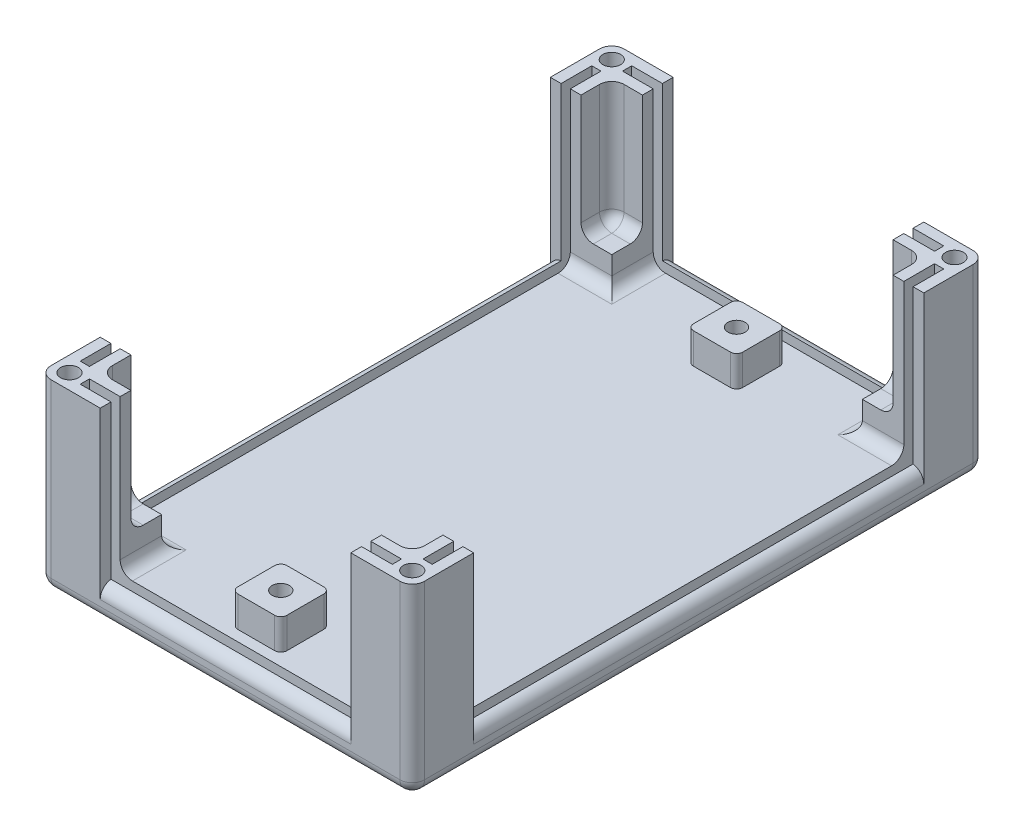
from build123d import *

# Parameters (mm, degrees)
SKETCH1_W           = 60.8
SKETCH1_H           = 93.28
SKETCH1_R           = 1.4
BOSS_EXTRUDE1_DEPTH = 5
BOSS_EXTRUDE3_DEPTH = 30
BOSS_EXTRUDE4_START = 5
SKETCH1_6_W         = 8
SKETCH1_6_H         = 8
SKETCH1_6_R         = 1.4
BOSS_EXTRUDE4_DEPTH = 5
SKETCH1_8_R         = 1.4
CUT_EXTRUDE4_DEPTH  = 2.3
SKETCH4_W           = 5
SKETCH4_H           = 5
BOSS_EXTRUDE5_DEPTH = 5
SKETCH2_W           = 1.5
SKETCH2_H           = 83.28
SKETCH2_W_2         = 50.8
SKETCH2_H_2         = 1.5
SKETCH2_H_3         = 78.28
SKETCH2_W_3         = 45.8
SKETCH2_W_4         = 5
SKETCH2_H_4         = 5
CUT_EXTRUDE1_DEPTH  = 27
SKETCH2_3_R         = 1.45
CUT_EXTRUDE2_DEPTH  = 15
SKETCH3_W           = 34
SKETCH3_H           = 34
CUT_EXTRUDE3_DEPTH  = 2
FILLET1_R           = 2
FILLET3_R           = 1
FILLET5_R           = 4
FILLET6_R           = 2


with BuildPart() as part:
    # Sketch1 → Boss-Extrude1 (new body)
    with BuildSketch(Plane(origin=(0, 0, 0), x_dir=(1, 0, 0), z_dir=(0, 1, 0))):
        Rectangle(SKETCH1_W, SKETCH1_H)
        with Locations(Location((0, -37.64, 0), (0, 0, 270))):
            Circle(SKETCH1_R, mode=Mode.SUBTRACT)
        with Locations(Location((0, 36.56, 0), (0, 0, 270))):
            Circle(SKETCH1_R, mode=Mode.SUBTRACT)
    extrude(amount=BOSS_EXTRUDE1_DEPTH)

    # Sketch1<4> → Boss-Extrude3 (add)
    with BuildSketch(Plane(origin=(0, 0, 0), x_dir=(1, 0, 0), z_dir=(0, 1, 0))):
        Polygon((-20.4, 41.64), (-20.4, 46.64), (-30.4, 46.64), (-30.4, 36.64), (-25.4, 36.64), (-25.4, 41.64), align=None)
        Polygon((25.4, 36.64), (30.4, 36.64), (30.4, 46.64), (20.4, 46.64), (20.4, 41.64), (25.4, 41.64), align=None)
        Polygon((20.4, -46.64), (30.4, -46.64), (30.4, -36.64), (25.4, -36.64), (25.4, -41.64), (20.4, -41.64), align=None)
        Polygon((-30.4, -46.64), (-20.4, -46.64), (-20.4, -41.64), (-25.4, -41.64), (-25.4, -36.64), (-30.4, -36.64), align=None)
    extrude(amount=BOSS_EXTRUDE3_DEPTH)

    # Sketch1<6> → Boss-Extrude4 (add)
    # profile 1 of 2: a face of its own
    with BuildSketch(Plane(origin=(0, 0, 0), x_dir=(1, 0, 0), z_dir=(0, 1, 0)).offset(BOSS_EXTRUDE4_START)):
        with Locations((0, -37.64)):
            Rectangle(SKETCH1_6_W, SKETCH1_6_H)
        with Locations(Location((0, -37.64, 0), (0, 0, 270))):
            Circle(SKETCH1_6_R, mode=Mode.SUBTRACT)
    # profile 2 of 2: a face of its own
    with BuildSketch(Plane(origin=(0, 0, 0), x_dir=(1, 0, 0), z_dir=(0, 1, 0)).offset(BOSS_EXTRUDE4_START)):
        with Locations((0, 36.56)):
            Rectangle(SKETCH1_6_W, SKETCH1_6_H)
        with Locations(Location((0, 36.56, 0), (0, 0, 270))):
            Circle(SKETCH1_6_R, mode=Mode.SUBTRACT)
    extrude(amount=BOSS_EXTRUDE4_DEPTH)

    # Sketch1<8> → Cut-Extrude4 (cut)
    # profile 1 of 2: a face of its own
    with BuildSketch(Plane(origin=(0, 0, 0), x_dir=(1, 0, 0), z_dir=(0, 1, 0))):
        Polygon((-1.58771324, -40.39), (1.58771324, -40.39), (3.175426481, -37.64), (1.58771324, -34.89), (-1.58771324, -34.89), (-3.175426481, -37.64), align=None)
        with Locations(Location((0, -37.64, 0), (0, 0, 270))):
            Circle(SKETCH1_8_R, mode=Mode.SUBTRACT)
    # profile 2 of 2: a face of its own
    with BuildSketch(Plane(origin=(0, 0, 0), x_dir=(1, 0, 0), z_dir=(0, 1, 0))):
        Polygon((-1.58771324, 33.81), (1.58771324, 33.81), (3.175426481, 36.56), (1.58771324, 39.31), (-1.58771324, 39.31), (-3.175426481, 36.56), align=None)
        with Locations(Location((0, 36.56, 0), (0, 0, 270))):
            Circle(SKETCH1_8_R, mode=Mode.SUBTRACT)
    extrude(amount=CUT_EXTRUDE4_DEPTH, mode=Mode.SUBTRACT)

    # Sketch4 → Boss-Extrude5 (add)
    with BuildSketch(Plane(origin=(0, 5, 0), x_dir=(1, 0, 0), z_dir=(0, 1, 0))):
        with Locations((-22.9, -39.14)):
            Rectangle(SKETCH4_W, SKETCH4_H)
        with Locations((-22.9, 39.14)):
            Rectangle(SKETCH4_W, SKETCH4_H)
        with Locations((22.9, 39.14)):
            Rectangle(SKETCH4_W, SKETCH4_H)
        with Locations((22.9, -39.14)):
            Rectangle(SKETCH4_W, SKETCH4_H)
    extrude(amount=BOSS_EXTRUDE5_DEPTH)

    # Sketch2 → Cut-Extrude1 (cut)
    with BuildSketch(Plane(origin=(0, 30, 0), x_dir=(1, 0, 0), z_dir=(0, 1, 0))):
        with Locations((27.9, 0)):
            Rectangle(SKETCH2_W, SKETCH2_H)
        with Locations((0, -44.14)):
            Rectangle(SKETCH2_W_2, SKETCH2_H_2)
        with Locations((-27.9, -2.5)):
            Rectangle(SKETCH2_W, SKETCH2_H_3)
        with Locations((2.5, 44.14)):
            Rectangle(SKETCH2_W_3, SKETCH2_H_2)
        with Locations((-22.9, 44.14)):
            Rectangle(SKETCH2_W_4, SKETCH2_H_2)
        with Locations((-27.9, 39.14)):
            Rectangle(SKETCH2_W, SKETCH2_H_4)
    extrude(amount=-CUT_EXTRUDE1_DEPTH, mode=Mode.SUBTRACT)

    # Sketch2<3> → Cut-Extrude2 (cut)
    with BuildSketch(Plane(origin=(0, 30, 0), x_dir=(1, 0, 0), z_dir=(0, 1, 0))):
        with Locations(Location((27.9, -44.14, 0), (0, 0, 270))):
            Circle(SKETCH2_3_R)
        with Locations(Location((-27.9, -44.14, 0), (0, 0, 90))):
            Circle(SKETCH2_3_R)
        with Locations(Location((-27.9, 44.14, 0), (0, 0, 270))):
            Circle(SKETCH2_3_R)
        with Locations(Location((27.9, 44.14, 0), (0, 0, 90))):
            Circle(SKETCH2_3_R)
    extrude(amount=-CUT_EXTRUDE2_DEPTH, mode=Mode.SUBTRACT)

    # Sketch3 → Cut-Extrude3 (cut)
    with BuildSketch(Plane.XZ):
        Rectangle(SKETCH3_W, SKETCH3_H)
    extrude(amount=-CUT_EXTRUDE3_DEPTH, mode=Mode.SUBTRACT)

    # Fillet1
    # the kernel refuses this fillet: 2 mm, written as the material it adds along each edge
    with BuildSketch(Plane(origin=(-25.4, 5, 41.64), x_dir=(0, 0, -1), z_dir=(0, 1, 0)), Plane(origin=(-25.4, 5, -41.64), x_dir=(1, 0, 0), z_dir=(0, 1, 0)), Plane(origin=(25.4, 5, 41.64), x_dir=(-1, 0, 0), z_dir=(0, 1, 0)), Plane(origin=(25.4, 5, -41.64), x_dir=(0, 0, 1), z_dir=(0, 1, 0))) as fillet1_piece_1:
        with BuildLine():
            CenterArc((FILLET1_R, -FILLET1_R), FILLET1_R, 90, 90)
            Line((0, -FILLET1_R), (0, 0))
            Line((0, 0), (FILLET1_R, 0))
        make_face()
    extrude(amount=25)
    # the kernel refuses this fillet: 2 mm, written as the material it takes off along each edge
    with BuildSketch(Plane(origin=(28.4, 2, 44.64), x_dir=(0, -1, 0), z_dir=(1, 0, 0))) as fillet1_2_piece_1_section:
        Polygon((0, 0), (FILLET1_R * 1.02, 0), (FILLET1_R * 1.02, -FILLET1_R * 1.02), (0, -FILLET1_R * 1.02), align=None)
    fillet1_2_piece_1 = extrude(amount=FILLET1_R * 1.02, mode=Mode.PRIVATE)
    fillet1_2_piece_1 = fillet1_2_piece_1 - Plane(origin=(28.4, 2, 44.64), x_dir=(0, 0.7071067811865475, -0.7071067811865475), z_dir=(1, 0, 0)) * Sphere(FILLET1_R, mode=Mode.PRIVATE)
    add(fillet1_2_piece_1, mode=Mode.SUBTRACT)
    with BuildSketch(Plane(origin=(-28.4, 2, 44.64), x_dir=(0, 0, 1), z_dir=(-1, 0, 0))) as fillet1_2_piece_2_section:
        Polygon((0, 0), (FILLET1_R * 1.02, 0), (FILLET1_R * 1.02, -FILLET1_R * 1.02), (0, -FILLET1_R * 1.02), align=None)
    fillet1_2_piece_2 = extrude(amount=FILLET1_R * 1.02, mode=Mode.PRIVATE)
    fillet1_2_piece_2 = fillet1_2_piece_2 - Plane(origin=(-28.4, 2, 44.64), x_dir=(0, 0.7071067811865475, -0.7071067811865475), z_dir=(-1, 0, 0)) * Sphere(FILLET1_R, mode=Mode.PRIVATE)
    add(fillet1_2_piece_2, mode=Mode.SUBTRACT)
    with BuildSketch(Plane(origin=(-28.4, 2, -44.64), x_dir=(-1, 0, 0), z_dir=(0, 0, -1))) as fillet1_2_piece_3_section:
        Polygon((0, 0), (FILLET1_R * 1.02, 0), (FILLET1_R * 1.02, -FILLET1_R * 1.02), (0, -FILLET1_R * 1.02), align=None)
    fillet1_2_piece_3 = extrude(amount=FILLET1_R * 1.02, mode=Mode.PRIVATE)
    fillet1_2_piece_3 = fillet1_2_piece_3 - Plane(origin=(-28.4, 2, -44.64), x_dir=(0.7071067811865475, 0.7071067811865475, 0), z_dir=(0, 0, -1)) * Sphere(FILLET1_R, mode=Mode.PRIVATE)
    add(fillet1_2_piece_3, mode=Mode.SUBTRACT)
    with BuildSketch(Plane(origin=(28.4, 2, -44.64), x_dir=(0, 0, -1), z_dir=(1, 0, 0))) as fillet1_2_piece_4_section:
        Polygon((0, 0), (FILLET1_R * 1.02, 0), (FILLET1_R * 1.02, -FILLET1_R * 1.02), (0, -FILLET1_R * 1.02), align=None)
    fillet1_2_piece_4 = extrude(amount=FILLET1_R * 1.02, mode=Mode.PRIVATE)
    fillet1_2_piece_4 = fillet1_2_piece_4 - Plane(origin=(28.4, 2, -44.64), x_dir=(0, 0.7071067811865475, 0.7071067811865475), z_dir=(1, 0, 0)) * Sphere(FILLET1_R, mode=Mode.PRIVATE)
    add(fillet1_2_piece_4, mode=Mode.SUBTRACT)
    with BuildSketch(Plane(origin=(20.4, 5, -46.64), x_dir=(0, -1, 0), z_dir=(-1, 0, 0)), Plane(origin=(-20.4, 5, 46.64), x_dir=(0, -1, 0), z_dir=(1, 0, 0))) as fillet1_2_piece_5:
        with BuildLine():
            CenterArc((1.984313483, 2), FILLET1_R, 187.180755781, 82.819244219)
            Line((0, 1.75), (0, 0))
            Line((0, 0), (1.984313483, 0))
        make_face()
    extrude(amount=40.8, mode=Mode.SUBTRACT)
    with BuildSketch(Plane(origin=(30.4, 5, 36.64), x_dir=(0, -1, 0), z_dir=(0, 0, -1)), Plane(origin=(-30.4, 5, -36.64), x_dir=(0, -1, 0), z_dir=(0, 0, 1))) as fillet1_2_piece_6:
        with BuildLine():
            CenterArc((1.984313483, 2), FILLET1_R, 187.180755781, 82.819244219)
            Line((0, 1.75), (0, 0))
            Line((0, 0), (1.984313483, 0))
        make_face()
    extrude(amount=73.28, mode=Mode.SUBTRACT)
    with BuildSketch(Plane(origin=(30.4, 35, 46.64), x_dir=(0, 0, -1), z_dir=(0, -1, 0)), Plane(origin=(-30.4, 35, 46.64), x_dir=(1, 0, 0), z_dir=(0, -1, 0)), Plane(origin=(30.4, 2, -46.64), x_dir=(0, 0, 1), z_dir=(0, 1, 0))) as fillet1_2_piece_7:
        with BuildLine():
            CenterArc((FILLET1_R, -FILLET1_R), FILLET1_R, 90, 90)
            Line((0, -FILLET1_R), (0, 0))
            Line((0, 0), (FILLET1_R, 0))
        make_face()
    extrude(amount=33, mode=Mode.SUBTRACT)
    with BuildSketch(Plane(origin=(-30.4, 35, -46.64), x_dir=(1, 0, 0), z_dir=(0, -1, 0))) as fillet1_2_piece_8:
        with BuildLine():
            CenterArc((FILLET1_R, FILLET1_R), FILLET1_R, 180, 90)
            Line((0, FILLET1_R), (0, 0))
            Line((0, 0), (FILLET1_R, 0))
        make_face()
    extrude(amount=33, mode=Mode.SUBTRACT)
    with BuildSketch(Plane(origin=(-28.4, 0, -46.64), x_dir=(0, 0, 1), z_dir=(1, 0, 0)), Plane(origin=(28.4, 0, 46.64), x_dir=(0, 0, -1), z_dir=(-1, 0, 0))) as fillet1_2_piece_9:
        with BuildLine():
            CenterArc((FILLET1_R, -FILLET1_R), FILLET1_R, 90, 90)
            Line((0, -FILLET1_R), (0, 0))
            Line((0, 0), (FILLET1_R, 0))
        make_face()
    extrude(amount=56.8, mode=Mode.SUBTRACT)
    with BuildSketch(Plane(origin=(-30.4, 0, 44.64), x_dir=(1, 0, 0), z_dir=(0, 0, -1)), Plane(origin=(30.4, 0, 44.64), x_dir=(0, 1, 0), z_dir=(0, 0, -1))) as fillet1_2_piece_10:
        with BuildLine():
            CenterArc((FILLET1_R, -FILLET1_R), FILLET1_R, 90, 90)
            Line((0, -FILLET1_R), (0, 0))
            Line((0, 0), (FILLET1_R, 0))
        make_face()
    extrude(amount=89.28, mode=Mode.SUBTRACT)

    # Fillet3
    fillet3_edges = [part.edges().sort_by_distance(p)[0] for p in [
        (-4, 7.5, 33.64),
        (-4, 7.5, 41.64),
        (4, 7.5, 41.64),
        (4, 7.5, 33.64),
        (-4, 7.5, -40.56),
        (-4, 7.5, -32.56),
        (4, 7.5, -32.56),
        (4, 7.5, -40.56),
    ]]
    fillet(fillet3_edges, radius=FILLET3_R)

    # Fillet5
    fillet5_edges = [part.edges().sort_by_distance(p)[0] for p in [
        (17, 1, 17),
        (17, 1, -17),
        (-17, 1, -17),
        (-17, 1, 17),
    ]]
    fillet(fillet5_edges, radius=FILLET5_R)

    # Fillet6
    fillet6_edges = [part.edges().sort_by_distance(p)[0] for p in [
        (-25.4, 10, 38.14),
        (-21.9, 10, -41.64),
        (25.4, 10, -38.14),
        (21.9, 10, 41.64),
        (-20.4, 5, 40.015),
        (-23.775, 5, 36.64),
        (23.775, 5, 36.64),
        (20.4, 5, 40.015),
        (23.775, 5, -36.64),
        (20.4, 5, -40.015),
        (-20.4, 5, -40.015),
        (-23.775, 5, -36.64),
        (-21.9, 10, 41.64),
        (-24.814213562, 10, 41.054213562),
        (-25.4, 10, -38.14),
        (-24.814213562, 10, -41.054213562),
        (25.4, 10, 38.14),
        (24.814213562, 10, 41.054213562),
        (21.9, 10, -41.64),
        (24.814213562, 10, -41.054213562),
    ]]
    fillet(fillet6_edges, radius=FILLET6_R)


solid = part.part
